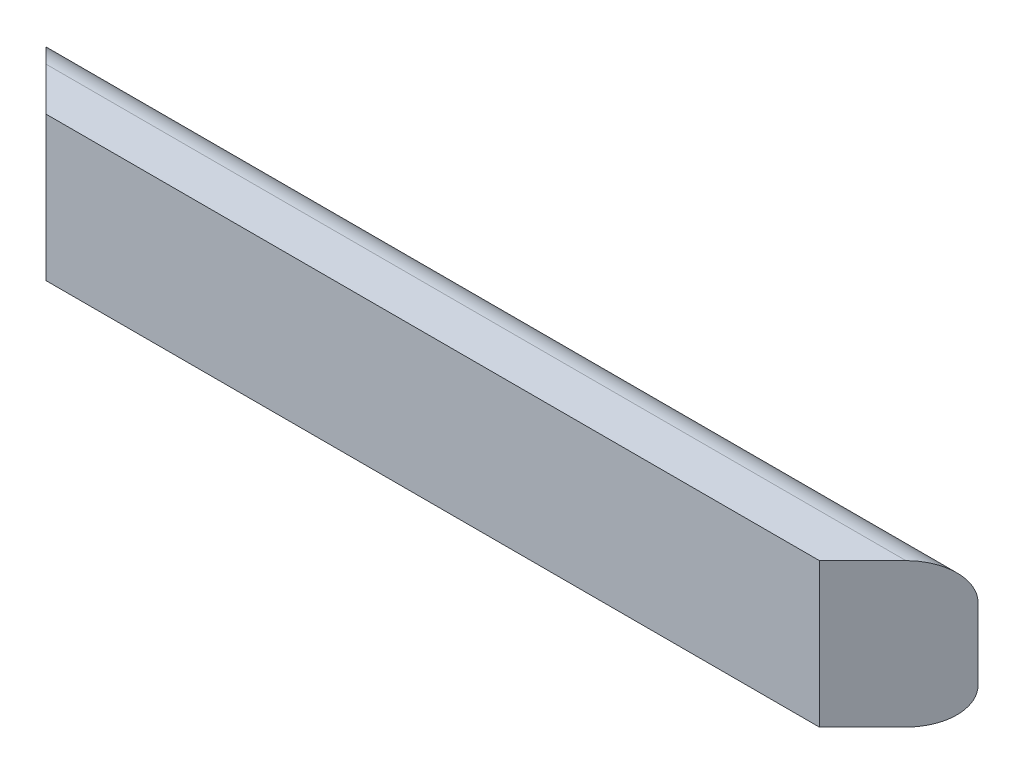
from build123d import *

# Parameters (mm, degrees)
BOSS_EXTRUDE1_DEPTH      = 410.337
BOSS_EXTRUDE1_DEPTH_BACK = 410.337
CUT_EXTRUDE1_DEPTH       = 436.183267221


with BuildPart() as part:
    # Sketch1 → Boss-Extrude1 (new, two sides: drawn at the far end of the back side and taken through both)
    with BuildSketch(Plane(origin=(0, 0, 0), x_dir=(0, 0, -1), z_dir=(1, 0, 0)).offset(-BOSS_EXTRUDE1_DEPTH_BACK)):
        with BuildLine():
            Line((6.35, 127), (38.1, 127))
            ThreePointArc((38.1, 127), (60.550640303, 117.700640303), (69.85, 95.25))
            Line((69.85, 95.25), (69.85, 31.75))
            ThreePointArc((69.85, 31.75), (60.550640303, 9.299359697), (38.1, 0))
            Line((38.1, 0), (6.35, 0))
            Line((6.35, 0), (0, 0))
            Line((0, 0), (0, 127))
            Line((0, 127), (6.35, 127))
        make_face()
    extrude(amount=BOSS_EXTRUDE1_DEPTH + BOSS_EXTRUDE1_DEPTH_BACK)

    # Sketch2 → Cut-Extrude1 (cut, through all)
    with BuildSketch(Plane(origin=(0, 127, 0), x_dir=(1, 0, 0), z_dir=(0, 1, 0))):
        Polygon((410.337, 69.85), (340.487, 0), (410.337, 0), align=None)
        Polygon((-410.337, 69.85), (-340.487, 0), (-410.337, 0), align=None)
    extrude(amount=-CUT_EXTRUDE1_DEPTH, mode=Mode.SUBTRACT)


solid = part.part
